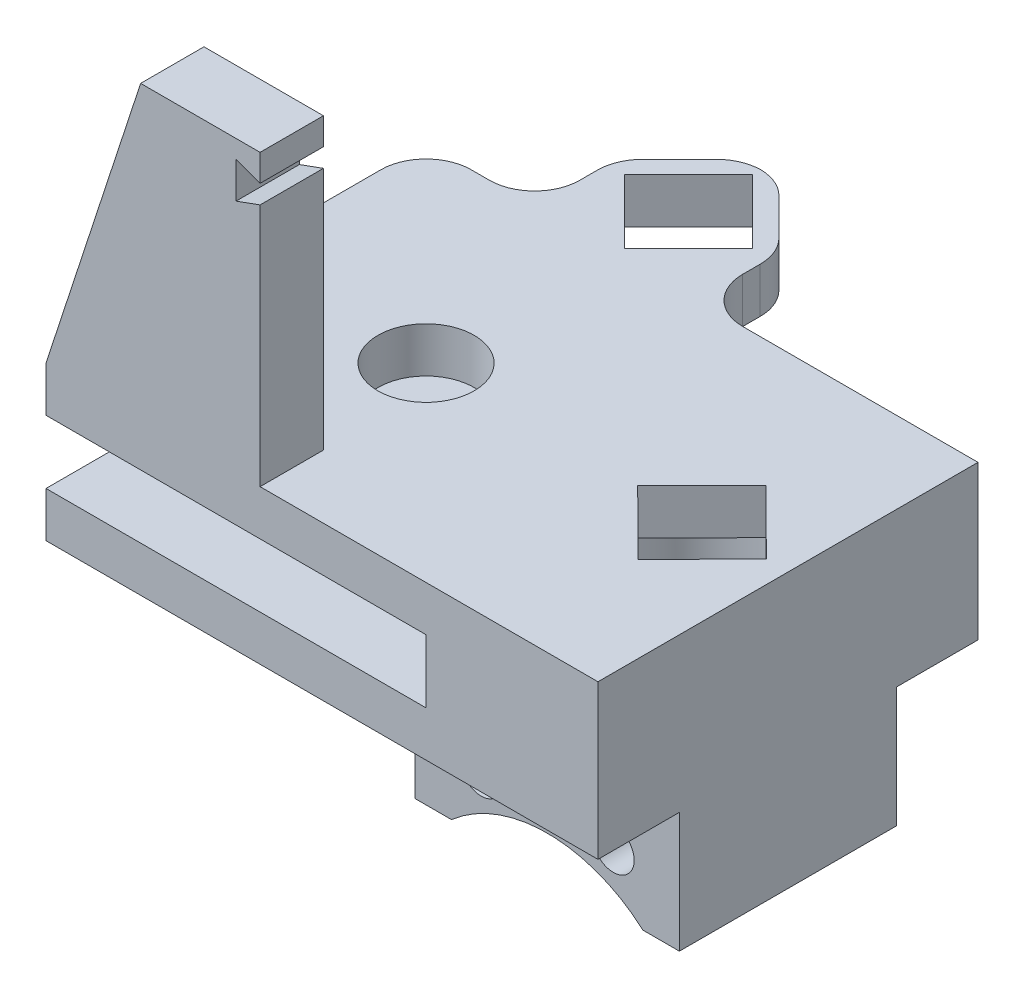
from build123d import *

# Parameters (mm, degrees)
SKETCH1_R            = 3.3782
BOSS_EXTRUDE1_DEPTH  = 3.175
BOSS_EXTRUDE2_DEPTH  = 4.445
SKETCH7_W            = 18.542
SKETCH7_H            = 15.24
BOSS_EXTRUDE4_DEPTH  = 8.43915
SKETCH8_R            = 1.4605
CUT_EXTRUDE3_DEPTH   = 37.635615509
SKETCH9_R            = 10.16
CUT_EXTRUDE4_DEPTH   = 37.635615509
CUT_EXTRUDE6_DEPTH   = 9.525
SKETCH23_R           = 4.490128061
CUT_EXTRUDE7_DEPTH   = 6.35
BOSS_EXTRUDE10_DEPTH = 3.175
BOSS_EXTRUDE11_DEPTH = 3.175
SKETCH19_W           = 8.382
SKETCH19_H           = 4.445
BOSS_EXTRUDE12_DEPTH = 20.32
BOSS_EXTRUDE13_DEPTH = 4.445
CUT_EXTRUDE5_DEPTH   = 12.7
SKETCH24_W           = 48.736365122
SKETCH24_H           = 10.862134757
CUT_EXTRUDE8_DEPTH   = 30.48
SKETCH26_W           = 11.43
SKETCH26_H           = 10.16
BOSS_EXTRUDE15_DEPTH = 3.175
CHAMFER1_SIZE        = 4.445
FILLET1_R            = 3.175


with BuildPart() as part:
    # Sketch1 → Boss-Extrude1 (new body)
    with BuildSketch(Plane(origin=(0, 0, 0), x_dir=(1, 0, 0), z_dir=(0, 1, 0))):
        with BuildLine():
            Line((0, -13.335), (25.4, -13.335))
            Line((25.4, -13.335), (25.4, 13.335))
            Line((25.4, 13.335), (0, 13.335))
            ThreePointArc((0, 13.335), (-13.335, 0), (0, -13.335))
        make_face()
        with Locations(Location((0, 0, 0), (0, 0, 270))):
            Circle(SKETCH1_R, mode=Mode.SUBTRACT)
    boss_extrude1 = extrude(amount=BOSS_EXTRUDE1_DEPTH)

    # Sketch2 → Boss-Extrude2 (add)
    with BuildSketch(Plane(origin=(0, 0, 0), x_dir=(-1, 0, 0), z_dir=(0, -1, 0))):
        Polygon((-25.4, 13.335), (-25.4, -13.335), (-13.335, -13.335), (-13.335, 0), (-13.335, 13.335), align=None)
    extrude(amount=BOSS_EXTRUDE2_DEPTH)

    # Mirror2: Boss-Extrude1 across plane
    add(boss_extrude1.mirror(Plane(origin=(0, -2.2225, 0), x_dir=(0, 0, 1), z_dir=(0, -1, 0))))

    # Sketch7 → Boss-Extrude4 (add)
    with BuildSketch(Plane(origin=(0, -7.62, 0), x_dir=(-1, 0, 0), z_dir=(0, -1, 0))):
        with Locations((-16.129, 0)):
            Rectangle(SKETCH7_W, SKETCH7_H)
    extrude(amount=BOSS_EXTRUDE4_DEPTH)

    # Sketch8 → Cut-Extrude3 (cut, through all)
    with BuildSketch(Plane(origin=(0, 0, -7.62), x_dir=(-1, 0, 0), z_dir=(0, 0, -1))):
        with Locations((-20.7645, -12.1285)):
            Circle(SKETCH8_R)
        with Locations((-11.4935, -12.1285)):
            Circle(SKETCH8_R)
    extrude(amount=-CUT_EXTRUDE3_DEPTH, mode=Mode.SUBTRACT)

    # Sketch9 → Cut-Extrude4 (cut, through all)
    with BuildSketch(Plane(origin=(0, 0, -7.62), x_dir=(-1, 0, 0), z_dir=(0, 0, -1))):
        with Locations((-16.129, -23.67915)):
            Circle(SKETCH9_R)
    extrude(amount=-CUT_EXTRUDE4_DEPTH, mode=Mode.SUBTRACT)

    # Sketch22 → Cut-Extrude6 (cut)
    with BuildSketch(Plane(origin=(0, 3.175, 0), x_dir=(1, 0, 0), z_dir=(0, 1, 0))):
        Polygon((19.3675, -4.490128061), (23.857563833, 0.024016226), (19.3675, 4.490128061), (14.877436167, -0.024016226), align=None)
    extrude(amount=-CUT_EXTRUDE6_DEPTH, mode=Mode.SUBTRACT)

    # Sketch23 → Cut-Extrude7 (cut)
    with BuildSketch(Plane(origin=(0, -6.35, 0), x_dir=(1, 0, 0), z_dir=(0, 1, 0))):
        with Locations(Location((19.3675, 0, 0), (0, 0, 270))):
            Circle(SKETCH23_R)
    extrude(amount=CUT_EXTRUDE7_DEPTH, mode=Mode.SUBTRACT)

    # Sketch16 → Boss-Extrude10 (add)
    with BuildSketch(Plane(origin=(0, 3.175, 0), x_dir=(1, 0, 0), z_dir=(0, 1, 0))):
        Polygon((0, 13.335), (-13.335, 0), (-13.335, 13.335), align=None)
    boss_extrude10 = extrude(amount=-BOSS_EXTRUDE10_DEPTH)

    # Sketch17 → Boss-Extrude11 (add)
    with BuildSketch(Plane.XZ.offset(7.62)):
        Polygon((-13.335, -13.335), (-13.335, 0), (0, -13.335), align=None)
    boss_extrude11 = extrude(amount=-BOSS_EXTRUDE11_DEPTH)

    # Sketch19 → Boss-Extrude12 (add)
    with BuildSketch(Plane(origin=(0, 3.175, 0), x_dir=(1, 0, 0), z_dir=(0, 1, 0))):
        with Locations((-2.5019, 11.1125)):
            Rectangle(SKETCH19_W, SKETCH19_H)
    boss_extrude12 = extrude(amount=BOSS_EXTRUDE12_DEPTH)

    # Sketch20 → Boss-Extrude13 (add)
    with BuildSketch(Plane.XY.offset(-8.89)):
        Polygon((-6.6929, 23.495), (-13.335, 3.175), (-6.6929, 3.175), align=None)
    boss_extrude13 = extrude(amount=-BOSS_EXTRUDE13_DEPTH)

    # Sketch21 → Cut-Extrude5 (cut)
    with BuildSketch(Plane.XY.offset(-8.89)):
        Polygon((0, 22.225), (1.6891, 21.610217877), (1.6891, 20.299782123), (0, 19.685), align=None)
    cut_extrude5 = extrude(amount=-CUT_EXTRUDE5_DEPTH, mode=Mode.SUBTRACT)

    # Mirror3: Boss-Extrude10, Boss-Extrude11, Boss-Extrude12, Boss-Extrude13, Cut-Extrude5 across plane
    add(boss_extrude10.mirror(Plane.XY))
    add(boss_extrude11.mirror(Plane.XY))
    add(boss_extrude12.mirror(Plane.XY))
    add(boss_extrude13.mirror(Plane.XY))
    add(cut_extrude5.mirror(Plane.XY), mode=Mode.SUBTRACT)

    # Sketch24 → Cut-Extrude8 (cut)
    with BuildSketch(Plane(origin=(0, 3.175, 0), x_dir=(1, 0, 0), z_dir=(0, 1, 0))):
        with Locations((2.598122841, 11.203809408)):
            Rectangle(SKETCH24_W, SKETCH24_H)
    extrude(amount=CUT_EXTRUDE8_DEPTH, mode=Mode.SUBTRACT)

    # Sketch26 → Boss-Extrude15 (add)
    with BuildSketch(Plane(origin=(0, 3.175, 0), x_dir=(1, 0, 0), z_dir=(0, 1, 0))):
        with Locations((0, 18.415)):
            Rectangle(SKETCH26_W, SKETCH26_H)
        Polygon((4.490128061, 18.415), (0.007864628, 13.924878827), (-4.490128061, 18.415), (-0.007864628, 22.905121173), align=None, mode=Mode.SUBTRACT)
    extrude(amount=-BOSS_EXTRUDE15_DEPTH)

    # Chamfer1
    chamfer1_edges = [part.edges().sort_by_distance(p)[0] for p in [
        (5.715, 1.5875, -23.495),
        (-5.715, 1.5875, -23.495),
    ]]
    chamfer(chamfer1_edges, length=CHAMFER1_SIZE)

    # Fillet1
    # the kernel refuses this fillet: 3.175 mm, written as the material it adds along each edge
    with BuildSketch(Plane(origin=(-5.715, 3.175, -13.335), x_dir=(0, 0, -1), z_dir=(0, -1, 0))) as fillet1_piece_1:
        with BuildLine():
            CenterArc((FILLET1_R, -FILLET1_R), FILLET1_R, 90, 90)
            Line((0, -FILLET1_R), (0, 0))
            Line((0, 0), (FILLET1_R, 0))
        make_face()
    extrude(amount=3.175)
    with BuildSketch(Plane(origin=(5.715, 3.175, -13.335), x_dir=(0, 0, -1), z_dir=(0, -1, 0))) as fillet1_piece_2:
        with BuildLine():
            CenterArc((FILLET1_R, FILLET1_R), FILLET1_R, 180, 90)
            Line((0, FILLET1_R), (0, 0))
            Line((0, 0), (FILLET1_R, 0))
        make_face()
    extrude(amount=3.175)
    # the kernel refuses this fillet: 3.175 mm, written as the material it takes off along each edge
    with BuildSketch(Plane(origin=(-13.335, 11.1125, -13.335), x_dir=(1, 0, 0), z_dir=(0, -1, 0))) as fillet1_2_piece_1:
        with BuildLine():
            CenterArc((FILLET1_R, FILLET1_R), FILLET1_R, 180, 90)
            Line((0, FILLET1_R), (0, 0))
            Line((0, 0), (FILLET1_R, 0))
        make_face()
    extrude(amount=19.05, mode=Mode.SUBTRACT)
    with BuildSketch(Plane(origin=(-13.335, -15.5575, -13.335), x_dir=(1, 0, 0), z_dir=(0, 1, 0))) as fillet1_2_piece_2:
        with BuildLine():
            CenterArc((FILLET1_R, -FILLET1_R), FILLET1_R, 90, 90)
            Line((0, -FILLET1_R), (0, 0))
            Line((0, 0), (FILLET1_R, 0))
        make_face()
    extrude(amount=19.05, mode=Mode.SUBTRACT)
    with BuildSketch(Plane(origin=(-1.27, 6.462820151, -23.495), x_dir=(1, 0, 0), z_dir=(0, -1, 0)), Plane(origin=(-5.715, 6.462820151, -19.05), x_dir=(0.7071067811865476, 0, -0.7071067811865476), z_dir=(0, -1, 0)), Plane(origin=(1.27, 6.462820151, -23.495), x_dir=(0.7071067811865479, 0, 0.7071067811865472), z_dir=(0, -1, 0)), Plane(origin=(5.715, 6.462820151, -19.05), x_dir=(0, 0, 1), z_dir=(0, -1, 0))) as fillet1_2_piece_3:
        with BuildLine():
            CenterArc((FILLET1_R * 0.414213562373, FILLET1_R), FILLET1_R, 225, 45)
            Line((-FILLET1_R * 0.292893218813, FILLET1_R * 0.292893218813), (0, 0))
            Line((0, 0), (FILLET1_R * 0.414213562373, 0))
        make_face()
    extrude(amount=9.750640303, mode=Mode.SUBTRACT)


solid = part.part
